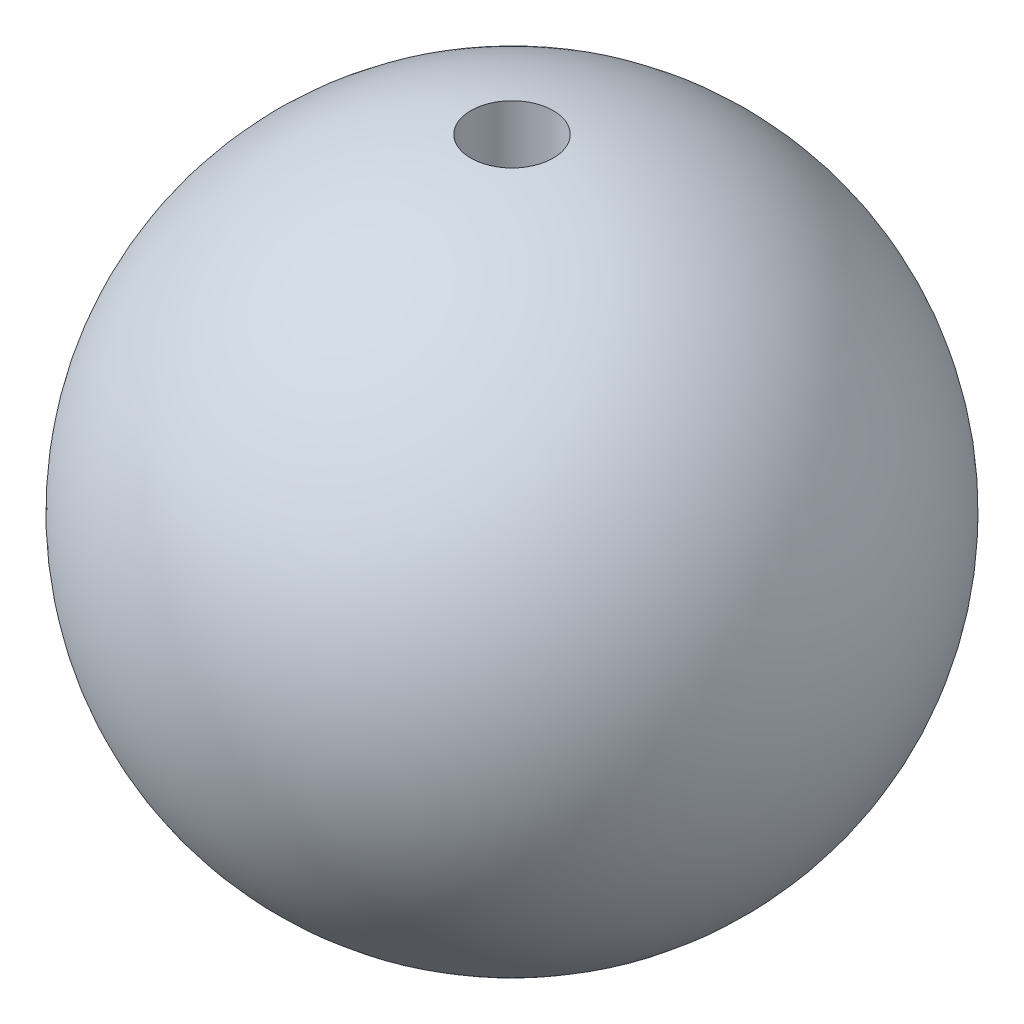
from build123d import *

# Parameters (mm, degrees)
SKETCH3_R          = 1.5875
CUT_EXTRUDE1_DEPTH = 22.997045256


with BuildPart() as part:
    # Sketch2 → Revolve1 (revolve)
    with BuildSketch(Plane.XY):
        with BuildLine():
            Line((0, 12.7), (0, -12.7))
            ThreePointArc((0, -12.7), (12.7, 0), (0, 12.7))
        make_face()
    revolve(axis=Axis((0, 0, 0), (0, 1, 0)))

    # Sketch3 → Cut-Extrude1 (cut, through all)
    with BuildSketch(Plane(origin=(0, 0, 0), x_dir=(1, 0, 0), z_dir=(0, 1, 0))):
        Circle(SKETCH3_R)
    extrude(amount=CUT_EXTRUDE1_DEPTH, mode=Mode.SUBTRACT)


solid = part.part
